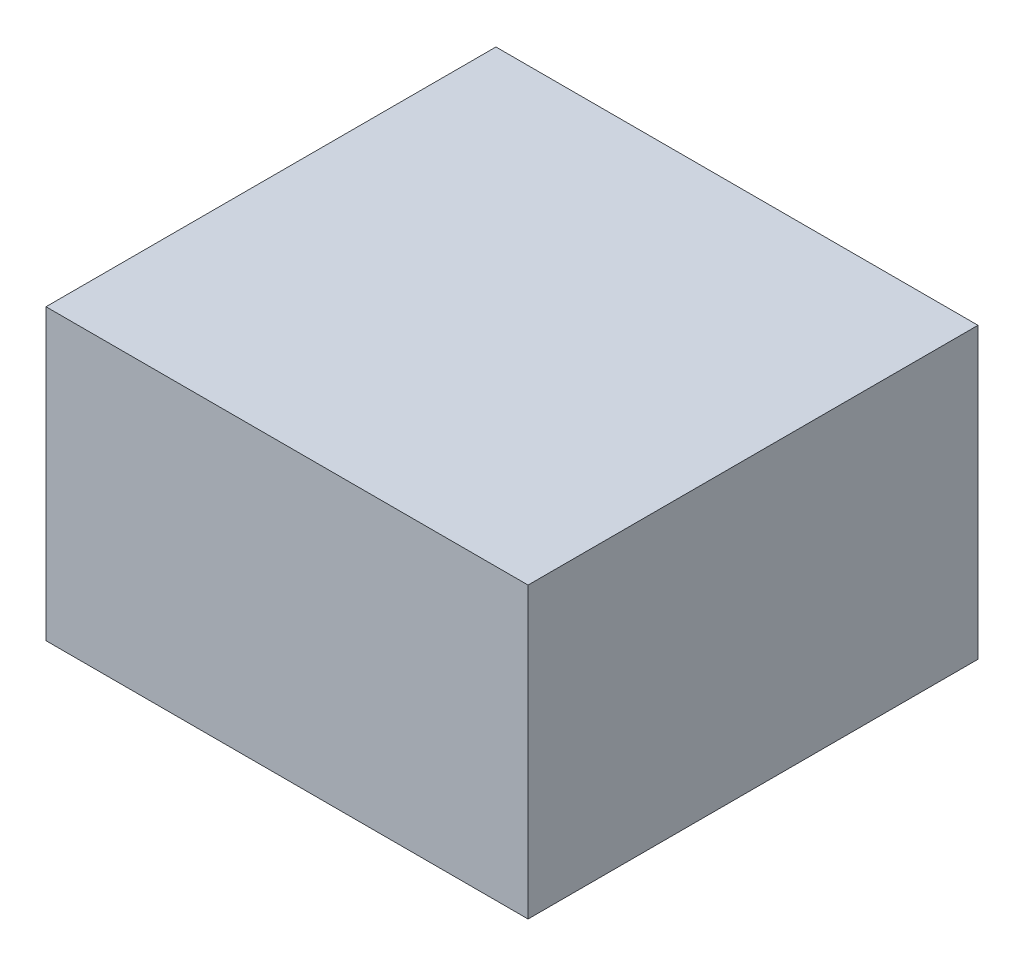
from build123d import *

# Parameters (mm, degrees)
SKETCH1_W           = 150
SKETCH1_H           = 140
BOSS_EXTRUDE1_DEPTH = 90


with BuildPart() as part:
    # Sketch1 → Boss-Extrude1 (new body)
    with BuildSketch(Plane(origin=(0, 0, 0), x_dir=(1, 0, 0), z_dir=(0, 1, 0))):
        Rectangle(SKETCH1_W, SKETCH1_H)
    extrude(amount=BOSS_EXTRUDE1_DEPTH)


solid = part.part
